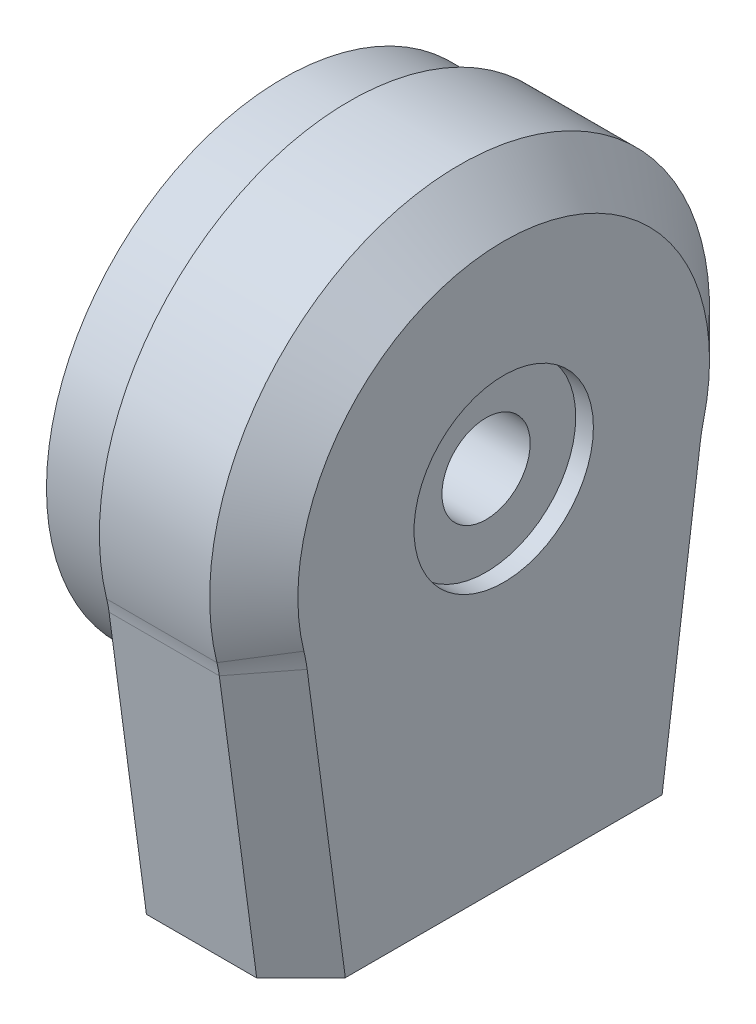
from build123d import *

# Parameters (mm, degrees)
BOSS_EXTRUDE1_START  = 65.9
BOSS_EXTRUDE1_DEPTH  = 10.5
BOSS_EXTRUDE2_START  = 65.8
BOSS_EXTRUDE2_DEPTH  = 0.6
CHAMFER1_SIZE        = 3
CHAMFER2_SIZE        = 3
BOSS_EXTRUDE3_START  = 62.7
SKETCH3_W            = 2.3
SKETCH3_H            = 23
BOSS_EXTRUDE3_DEPTH  = 6.6
BOSS_EXTRUDE4_START  = 54.5
SKETCH4_W            = 2.3
SKETCH4_H            = 6.6
BOSS_EXTRUDE4_DEPTH  = 23
BOSS_EXTRUDE5_START  = 65.9
SKETCH5_R            = 4.6
BOSS_EXTRUDE5_DEPTH  = 2.3
BOSS_EXTRUDE6_START  = 75.2
SKETCH6_R            = 6.1
BOSS_EXTRUDE6_DEPTH  = 1.7
BOSS_EXTRUDE7_START  = 68.1
SKETCH7_R            = 3
BOSS_EXTRUDE7_DEPTH  = 7.2
BOSS_EXTRUDE8_START  = 65.1
SKETCH8_W            = 6.1
SKETCH8_H            = 1.1
BOSS_EXTRUDE8_DEPTH  = 1.8
BOSS_EXTRUDE9_START  = 71.5
SKETCH9_W            = 6.1
SKETCH9_H            = 1.8
BOSS_EXTRUDE9_DEPTH  = 1.1
BOSS_EXTRUDE10_START = 65.1
SKETCH10_W           = 6.1
SKETCH10_H           = 1.1
BOSS_EXTRUDE10_DEPTH = 1.8
BOSS_EXTRUDE11_START = 59.4
SKETCH11_W           = 6.1
SKETCH11_H           = 1.8
BOSS_EXTRUDE11_DEPTH = 1.1
BOSS_EXTRUDE12_START = 65.1
SKETCH12_W           = 7.3
SKETCH12_H           = 3.4
BOSS_EXTRUDE12_DEPTH = 1.8
BOSS_EXTRUDE13_START = 72.6
SKETCH13_W           = 7.3
SKETCH13_H           = 1.8
BOSS_EXTRUDE13_DEPTH = 3.4
BOSS_EXTRUDE14_START = 65.1
SKETCH14_W           = 7.3
SKETCH14_H           = 3.4
BOSS_EXTRUDE14_DEPTH = 1.8
BOSS_EXTRUDE15_START = 56
SKETCH15_W           = 7.3
SKETCH15_H           = 1.8
BOSS_EXTRUDE15_DEPTH = 3.4
BOSS_EXTRUDE16_START = 64.4
BOSS_EXTRUDE16_DEPTH = 2.05
BOSS_EXTRUDE17_START = 61.4
SKETCH17_R           = 16.1
SKETCH17_R_2         = 15.2
BOSS_EXTRUDE17_DEPTH = 5.05
BOSS_EXTRUDE18_START = 63
SKETCH18_W           = 3.2
SKETCH18_H           = 4
BOSS_EXTRUDE18_DEPTH = 6
BOSS_EXTRUDE19_START = 26
SKETCH19_W           = 20
SKETCH19_H           = 56
BOSS_EXTRUDE19_DEPTH = 80


with BuildPart() as part:
    # Sketch1 → Boss-Extrude1 (new body)
    with BuildSketch(Plane(origin=(0, 0, 0), x_dir=(0, 0, -1), z_dir=(1, 0, 0)).offset(BOSS_EXTRUDE1_START)):
        with BuildLine():
            Line((-49.657293521, -24.929701405), (-54.04649339, -57.848700423))
            ThreePointArc((-54.04649339, -57.848700423), (-53.234221048, -59.119126346), (-52.95, -60.6))
            Line((-52.95, -60.6), (-52.95, -69.4))
            ThreePointArc((-52.95, -69.4), (-54.121572875, -72.228427125), (-56.95, -73.4))
            Line((-56.95, -73.4), (-85.85, -73.4))
            ThreePointArc((-85.85, -73.4), (-88.678427125, -72.228427125), (-89.85, -69.4))
            Line((-89.85, -69.4), (-89.85, -60.6))
            ThreePointArc((-89.85, -60.6), (-88.678427125, -57.771572875), (-85.85, -56.6))
            Line((-85.85, -56.6), (-78.12, -56.6))
            Line((-78.12, -56.6), (-82.342706479, -24.929701405))
            ThreePointArc((-82.342706479, -24.929701405), (-82.412282932, -24.49821266), (-82.505320186, -24.071167593))
            ThreePointArc((-82.505320186, -24.071167593), (-66, -3), (-49.494679814, -24.071167593))
            ThreePointArc((-49.494679814, -24.071167593), (-49.587717068, -24.49821266), (-49.657293521, -24.929701405))
        make_face()
    extrude(amount=BOSS_EXTRUDE1_DEPTH)


with BuildPart() as body_2:
    # Sketch2 → Boss-Extrude2 (new body)
    with BuildSketch(Plane(origin=(0, 0, 0), x_dir=(0, 0, -1), z_dir=(1, 0, 0)).offset(BOSS_EXTRUDE2_START)):
        with BuildLine():
            Line((-50.450275841, -24.823970429), (-54.893518409, -58.148289686))
            ThreePointArc((-54.893518409, -58.148289686), (-54.049936113, -59.247362039), (-53.75, -60.6))
            Line((-53.75, -60.6), (-53.75, -69.4))
            ThreePointArc((-53.75, -69.4), (-54.6872583, -71.6627417), (-56.95, -72.6))
            Line((-56.95, -72.6), (-85.85, -72.6))
            ThreePointArc((-85.85, -72.6), (-88.1127417, -71.6627417), (-89.05, -69.4))
            Line((-89.05, -69.4), (-89.05, -60.6))
            ThreePointArc((-89.05, -60.6), (-88.1127417, -58.3372583), (-85.85, -57.4))
            Line((-85.85, -57.4), (-77.206253549, -57.4))
            Line((-77.206253549, -57.4), (-81.549724159, -24.823970429))
            ThreePointArc((-81.549724159, -24.823970429), (-81.626258257, -24.34933281), (-81.728599236, -23.879583236))
            ThreePointArc((-81.728599236, -23.879583236), (-66, -3.8), (-50.271400764, -23.879583236))
            ThreePointArc((-50.271400764, -23.879583236), (-50.373741743, -24.34933281), (-50.450275841, -24.823970429))
        make_face()
    extrude(amount=BOSS_EXTRUDE2_DEPTH)


with BuildPart() as part_1:
    add(part.part)

    # Combine1: cut body 2
    add(body_2.part, mode=Mode.SUBTRACT)

    # Chamfer1
    chamfer1_edges = [part_1.edges().sort_by_distance(p)[0] for p in [
        (76.4, -41.389200914, 51.851893455),
        (76.4, -40.764850703, 80.23135324),
        (76.4, -24.49821266, 49.587717068),
        (76.4, -24.49821266, 82.412282932),
        (76.4, -3, 66),
    ]]
    chamfer(chamfer1_edges, length=CHAMFER1_SIZE)

    # Chamfer2
    chamfer2_edges = [part_1.edges().sort_by_distance(p)[0] for p in [
        (76.4, -56.6, 80.471725405),
        (76.4, -57.771572875, 88.678427125),
        (76.4, -57.786965833, 54.106263237),
        (76.4, -65, 89.85),
        (76.4, -65, 52.95),
        (76.4, -72.228427125, 88.678427125),
        (76.4, -72.228427125, 54.121572875),
        (76.4, -73.4, 71.4),
    ]]
    chamfer(chamfer2_edges, length=CHAMFER2_SIZE)


with BuildPart() as body_2_2:
    # Sketch3 → Boss-Extrude3 (new body)
    with BuildSketch(Plane.XY.offset(BOSS_EXTRUDE3_START)):
        with Locations((67.05, -20)):
            Rectangle(SKETCH3_W, SKETCH3_H)
    extrude(amount=BOSS_EXTRUDE3_DEPTH)


with BuildPart() as part_2:
    add(part_1.part)

    # Combine2: cut body 2 2
    add(body_2_2.part, mode=Mode.SUBTRACT)


with BuildPart() as body_2_3:
    # Sketch4 → Boss-Extrude4 (new body)
    with BuildSketch(Plane.XY.offset(BOSS_EXTRUDE4_START)):
        with Locations((67.05, -20)):
            Rectangle(SKETCH4_W, SKETCH4_H)
    extrude(amount=BOSS_EXTRUDE4_DEPTH)


with BuildPart() as part_3:
    add(part_2.part)

    # Combine3: cut body 2 3
    add(body_2_3.part, mode=Mode.SUBTRACT)


with BuildPart() as body_2_4:
    # Sketch5 → Boss-Extrude5 (new body)
    with BuildSketch(Plane(origin=(0, 0, 0), x_dir=(0, 0, -1), z_dir=(1, 0, 0)).offset(BOSS_EXTRUDE5_START)):
        with Locations((-66, -20)):
            Circle(SKETCH5_R)
    extrude(amount=BOSS_EXTRUDE5_DEPTH)


with BuildPart() as part_4:
    add(part_3.part)

    # Combine4: cut body 2 4
    add(body_2_4.part, mode=Mode.SUBTRACT)


with BuildPart() as body_2_5:
    # Sketch6 → Boss-Extrude6 (new body)
    with BuildSketch(Plane(origin=(0, 0, 0), x_dir=(0, 0, -1), z_dir=(1, 0, 0)).offset(BOSS_EXTRUDE6_START)):
        with Locations((-66, -20)):
            Circle(SKETCH6_R)
    extrude(amount=BOSS_EXTRUDE6_DEPTH)


with BuildPart() as part_5:
    add(part_4.part)

    # Combine5: cut body 2 5
    add(body_2_5.part, mode=Mode.SUBTRACT)


with BuildPart() as body_2_6:
    # Sketch7 → Boss-Extrude7 (new body)
    with BuildSketch(Plane(origin=(0, 0, 0), x_dir=(0, 0, -1), z_dir=(1, 0, 0)).offset(BOSS_EXTRUDE7_START)):
        with Locations((-66, -20)):
            Circle(SKETCH7_R)
    extrude(amount=BOSS_EXTRUDE7_DEPTH)


with BuildPart() as part_6:
    add(part_5.part)

    # Combine6: cut body 2 6
    add(body_2_6.part, mode=Mode.SUBTRACT)


with BuildPart() as body_2_7:
    # Sketch8 → Boss-Extrude8 (new body)
    with BuildSketch(Plane.XY.offset(BOSS_EXTRUDE8_START)):
        with Locations((71.15, -13.95)):
            Rectangle(SKETCH8_W, SKETCH8_H)
    extrude(amount=BOSS_EXTRUDE8_DEPTH)


with BuildPart() as part_7:
    add(part_6.part)

    # Combine7: cut body 2 7
    add(body_2_7.part, mode=Mode.SUBTRACT)


with BuildPart() as body_2_8:
    # Sketch9 → Boss-Extrude9 (new body)
    with BuildSketch(Plane.XY.offset(BOSS_EXTRUDE9_START)):
        with Locations((71.15, -20)):
            Rectangle(SKETCH9_W, SKETCH9_H)
    extrude(amount=BOSS_EXTRUDE9_DEPTH)


with BuildPart() as part_8:
    add(part_7.part)

    # Combine8: cut body 2 8
    add(body_2_8.part, mode=Mode.SUBTRACT)


with BuildPart() as body_2_9:
    # Sketch10 → Boss-Extrude10 (new body)
    with BuildSketch(Plane.XY.offset(BOSS_EXTRUDE10_START)):
        with Locations((71.15, -26.05)):
            Rectangle(SKETCH10_W, SKETCH10_H)
    extrude(amount=BOSS_EXTRUDE10_DEPTH)


with BuildPart() as part_9:
    add(part_8.part)

    # Combine9: cut body 2 9
    add(body_2_9.part, mode=Mode.SUBTRACT)


with BuildPart() as body_2_10:
    # Sketch11 → Boss-Extrude11 (new body)
    with BuildSketch(Plane.XY.offset(BOSS_EXTRUDE11_START)):
        with Locations((71.15, -20)):
            Rectangle(SKETCH11_W, SKETCH11_H)
    extrude(amount=BOSS_EXTRUDE11_DEPTH)


with BuildPart() as part_10:
    add(part_9.part)

    # Combine10: cut body 2 10
    add(body_2_10.part, mode=Mode.SUBTRACT)


with BuildPart() as body_2_11:
    # Sketch12 → Boss-Extrude12 (new body)
    with BuildSketch(Plane.XY.offset(BOSS_EXTRUDE12_START)):
        with Locations((71.75, -11.7)):
            Rectangle(SKETCH12_W, SKETCH12_H)
    extrude(amount=BOSS_EXTRUDE12_DEPTH)


with BuildPart() as part_11:
    add(part_10.part)

    # Combine11: cut body 2 11
    add(body_2_11.part, mode=Mode.SUBTRACT)


with BuildPart() as body_2_12:
    # Sketch13 → Boss-Extrude13 (new body)
    with BuildSketch(Plane.XY.offset(BOSS_EXTRUDE13_START)):
        with Locations((71.75, -20)):
            Rectangle(SKETCH13_W, SKETCH13_H)
    extrude(amount=BOSS_EXTRUDE13_DEPTH)


with BuildPart() as part_12:
    add(part_11.part)

    # Combine12: cut body 2 12
    add(body_2_12.part, mode=Mode.SUBTRACT)


with BuildPart() as body_2_13:
    # Sketch14 → Boss-Extrude14 (new body)
    with BuildSketch(Plane.XY.offset(BOSS_EXTRUDE14_START)):
        with Locations((71.75, -28.3)):
            Rectangle(SKETCH14_W, SKETCH14_H)
    extrude(amount=BOSS_EXTRUDE14_DEPTH)


with BuildPart() as part_13:
    add(part_12.part)

    # Combine13: cut body 2 13
    add(body_2_13.part, mode=Mode.SUBTRACT)


with BuildPart() as body_2_14:
    # Sketch15 → Boss-Extrude15 (new body)
    with BuildSketch(Plane.XY.offset(BOSS_EXTRUDE15_START)):
        with Locations((71.75, -20)):
            Rectangle(SKETCH15_W, SKETCH15_H)
    extrude(amount=BOSS_EXTRUDE15_DEPTH)


with BuildPart() as part_14:
    add(part_13.part)

    # Combine14: cut body 2 14
    add(body_2_14.part, mode=Mode.SUBTRACT)

    # Sketch16 → Boss-Extrude16 (add)
    with BuildSketch(Plane(origin=(0, 0, 0), x_dir=(0, 0, -1), z_dir=(1, 0, 0)).offset(BOSS_EXTRUDE16_START)):
        with BuildLine():
            Line((-51.904610688, -14.86969785), (-52.468426261, -15.074909936))
            ThreePointArc((-52.468426261, -15.074909936), (-66, -5.6), (-79.531573739, -15.074909936))
            Line((-79.531573739, -15.074909936), (-80.095389312, -14.86969785))
            ThreePointArc((-80.095389312, -14.86969785), (-66, -5), (-51.904610688, -14.86969785))
        make_face()
    extrude(amount=BOSS_EXTRUDE16_DEPTH)

    # Sketch17 → Boss-Extrude17 (add)
    with BuildSketch(Plane(origin=(0, 0, 0), x_dir=(0, 0, -1), z_dir=(1, 0, 0)).offset(BOSS_EXTRUDE17_START)):
        with Locations((-66, -20)):
            Circle(SKETCH17_R)
        with Locations((-66, -20)):
            Circle(SKETCH17_R_2, mode=Mode.SUBTRACT)
    extrude(amount=BOSS_EXTRUDE17_DEPTH)


with BuildPart() as body_2_15:
    # Sketch18 → Boss-Extrude18 (new body)
    with BuildSketch(Plane.XY.offset(BOSS_EXTRUDE18_START)):
        with Locations((64.8, -36)):
            Rectangle(SKETCH18_W, SKETCH18_H)
    extrude(amount=BOSS_EXTRUDE18_DEPTH)


with BuildPart() as part_15:
    add(part_14.part)

    # Combine15: cut body 2 15
    add(body_2_15.part, mode=Mode.SUBTRACT)


with BuildPart() as body_2_16:
    # Sketch19 → Boss-Extrude19 (new body)
    with BuildSketch(Plane.XY.offset(BOSS_EXTRUDE19_START)):
        with Locations((70, -72)):
            Rectangle(SKETCH19_W, SKETCH19_H)
    extrude(amount=BOSS_EXTRUDE19_DEPTH)


with BuildPart() as part_16:
    add(part_15.part)

    # Combine16: cut body 2 16
    add(body_2_16.part, mode=Mode.SUBTRACT)


solid = part_16.part
